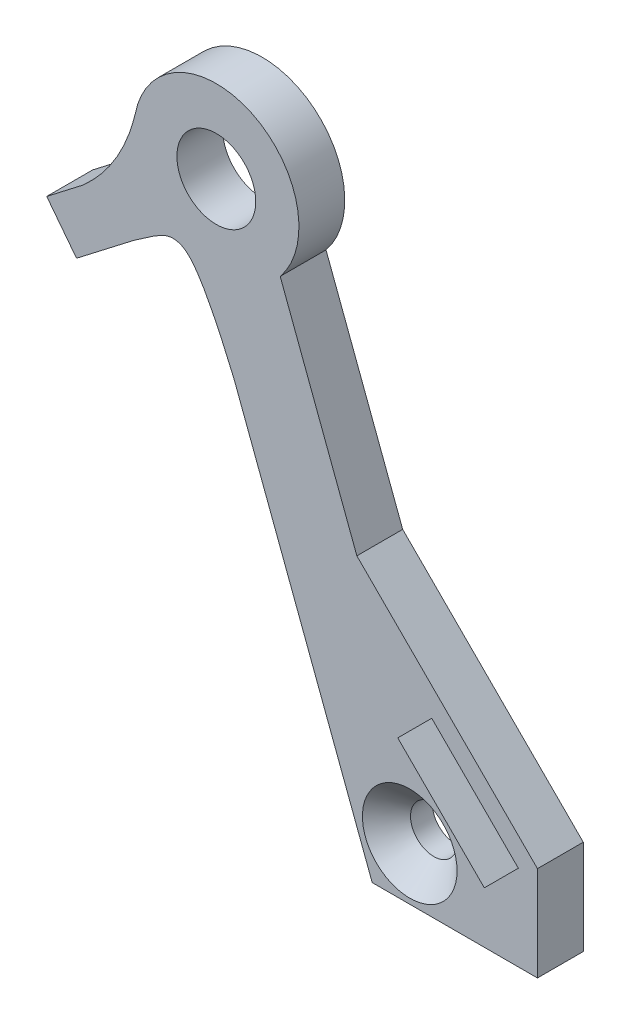
from build123d import *

# Parameters (mm, degrees)
SKETCH1_R           = 1.5
SKETCH1_R_2         = 2.625
BOSS_EXTRUDE1_DEPTH = 3.05


with BuildPart() as part:
    # Sketch1 → Boss-Extrude1 (new body)
    with BuildSketch(Plane.XY):
        with BuildLine():
            Line((-9.211968453, 24.473483865), (0, 0))
            Line((0, 0), (11, 0))
            Line((11, 0), (11, 6.303908615))
            Line((11, 6.303908615), (-1.02081528, 18.324723896))
            Line((-1.02081528, 18.324723896), (-6.124201376, 31.882915925))
            ThreePointArc((-6.124201376, 31.882915925), (-8.036687332, 40.349735284), (-15.775422064, 36.41824481))
            add(Edge.make_bspline(
                [(-19.24350489, 30.588131449), (-16.62983253, 32.913915268), (-15.775422064, 36.41824481)],
                knots=[0, 0, 0, 1, 1, 1], degree=2))
            Line((-19.24350489, 30.588131449), (-21.664019231, 28.72229072))
            Line((-21.664019231, 28.72229072), (-19.679850281, 26.148271766))
            Line((-19.679850281, 26.148271766), (-15.854192206, 29.09726014))
            add(Edge.make_bspline(
                [(-15.854192206, 29.09726014), (-14.302947432, 30.175241169), (-13.170817569, 31.075381759), (-11.397836612, 29.607825714), (-9.211968453, 24.473483865)],
                knots=[0, 0, 0, 0, 0.517103648, 1, 1, 1, 1], degree=3))
        make_face()
        with Locations((2.5, 3.5)):
            Circle(SKETCH1_R, mode=Mode.SUBTRACT)
        Polygon((9.727207794, 5.692209589), (7.517499103, 3.482500897), (7.464466094, 3.429467889), (1.701545827, 9.192388155), (3.964287527, 11.455129855), align=None, mode=Mode.SUBTRACT)
        with Locations((-10.375858941, 35.371957047)):
            Circle(SKETCH1_R_2, mode=Mode.SUBTRACT)
    extrude(amount=BOSS_EXTRUDE1_DEPTH)

    # Sketch3 → CSK for M3 Flat Head Machine Screw1 (revolve, cut)
    with BuildSketch(Plane(origin=(2.5, 3.5, 3.05), x_dir=(0, -1, 0), z_dir=(1, 0, 0))):
        Polygon((0, 0), (0, 3.05), (1.55, 3.05), (1.55, 1.6), (3.15, 0), align=None)
    revolve(axis=Axis((2.5, 3.5, 9.4), (0, 0, -1)), mode=Mode.SUBTRACT)


solid = part.part
